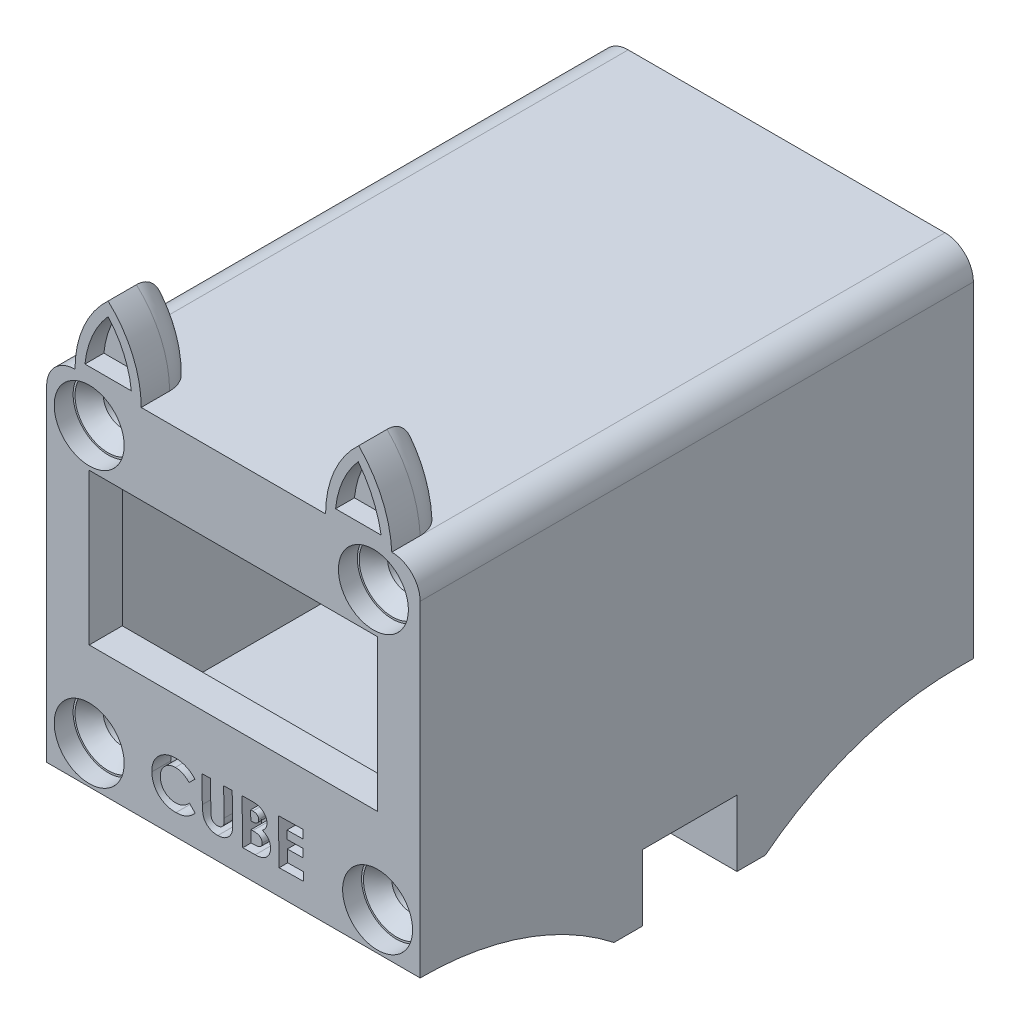
from build123d import *

# Parameters (mm, degrees)
ESQUISSE1_W              = 30.5
ESQUISSE1_H              = 16
BOSS_EXTRU_1_DEPTH       = 3.5
BOSS_EXTRU_2_START       = 55
BOSS_EXTRU_2_DEPTH       = 55
BOSS_EXTRU_3_START       = 1.5
BOSS_EXTRU_3_DEPTH       = 1.5
CONG_1_R                 = 2.5
ESQUISSE4_R              = 2
ENL_V_MAT_EXTRU_1_DEPTH  = 9.5
ESQUISSE5_R              = 3.7
ENL_V_MAT_EXTRU_5_DEPTH  = 2
BOSS_EXTRU_5_START       = -24.136848341
BOSS_EXTRU_5_OUTLINE_W   = 7.5
BOSS_EXTRU_5_OUTLINE_H   = 7
BOSS_EXTRU_5_DEPTH       = 6
BOSS_EXTRU_5_START_2     = 4.363151659
BOSS_EXTRU_5_2_OUTLINE_W = 7.5
BOSS_EXTRU_5_2_OUTLINE_H = 7
BOSS_EXTRU_5_2_DEPTH     = 6
BOSS_EXTRU_5_START_3     = -55
BOSS_EXTRU_5_3_OUTLINE_R = 2.25
BOSS_EXTRU_5_3_DEPTH     = 7
ESQUISSE7_W              = 0.5
ESQUISSE7_H              = 2.25
BOSS_EXTRU_6_DEPTH       = 7
CHANFREIN1_SIZE          = 1.5
ESQUISSE8_W              = 12.5
ESQUISSE8_H              = 5
ENL_V_MAT_EXTRU_6_DEPTH  = 2
BOSS_EXTRU_7_DEPTH       = 6
CONG_2_R                 = 3
ENL_V_MAT_EXTRU_7_DEPTH  = 2
ESQUISSE13_W             = 39.5
ESQUISSE13_H             = 3
BOSS_EXTRU_8_DEPTH       = 7
CONG_3_R                 = 33


with BuildPart() as part:
    # Esquisse1 → Boss.-Extru.1 (new body)
    with BuildSketch(Plane.XY):
        with BuildLine():
            Line((-17.882701422, 11.863151659), (15.617298578, 11.863151659))
            ThreePointArc((15.617298578, 11.863151659), (17.738618922, 10.984472002), (18.617298578, 8.863151659))
            Line((18.617298578, 8.863151659), (18.617298578, -25.636848341))
            Line((18.617298578, -25.636848341), (-20.882701422, -25.636848341))
            Line((-20.882701422, -25.636848341), (-20.882701422, 8.863151659))
            ThreePointArc((-20.882701422, 8.863151659), (-20.004021765, 10.984472002), (-17.882701422, 11.863151659))
        make_face()
        with Locations((-1.132701422, -4.636848341)):
            Rectangle(ESQUISSE1_W, ESQUISSE1_H, mode=Mode.SUBTRACT)
    extrude(amount=BOSS_EXTRU_1_DEPTH)

    # Esquisse2 → Boss.-Extru.2 (add)
    with BuildSketch(Plane(origin=(0, 0, 0), x_dir=(-1, 0, 0), z_dir=(0, 0, -1)).offset(BOSS_EXTRU_2_START)):
        with BuildLine():
            Line((-18.617298578, 8.863151659), (-18.617298578, -25.636848341))
            Line((-18.617298578, -25.636848341), (20.882701422, -25.636848341))
            Line((20.882701422, -25.636848341), (20.882701422, 8.863151659))
            ThreePointArc((20.882701422, 8.863151659), (20.004021765, 10.984472002), (17.882701422, 11.863151659))
            Line((17.882701422, 11.863151659), (-15.617298578, 11.863151659))
            ThreePointArc((-15.617298578, 11.863151659), (-17.738618922, 10.984472002), (-18.617298578, 8.863151659))
        make_face()
        with BuildLine():
            Line((-17.117298578, 8.863151659), (-17.117298578, -24.136848341))
            Line((-17.117298578, -24.136848341), (19.382701422, -24.136848341))
            Line((19.382701422, -24.136848341), (19.382701422, 8.863151659))
            ThreePointArc((19.382701422, 8.863151659), (18.943361594, 9.923811831), (17.882701422, 10.363151659))
            Line((17.882701422, 10.363151659), (-15.617298578, 10.363151659))
            ThreePointArc((-15.617298578, 10.363151659), (-16.67795875, 9.923811831), (-17.117298578, 8.863151659))
        make_face(mode=Mode.SUBTRACT)
    extrude(amount=-BOSS_EXTRU_2_DEPTH)

    # Esquisse3 → Boss.-Extru.3 (add)
    with BuildSketch(Plane(origin=(0, 0, 0), x_dir=(-1, 0, 0), z_dir=(0, 0, -1)).offset(BOSS_EXTRU_3_START)):
        with BuildLine():
            Line((-17.117298578, 8.863151659), (-17.117298578, 5.363151659))
            Line((-17.117298578, 5.363151659), (-5.117298578, 5.363151659))
            Line((-5.117298578, 5.363151659), (-5.117298578, 10.363151659))
            Line((-5.117298578, 10.363151659), (-15.617298578, 10.363151659))
            ThreePointArc((-15.617298578, 10.363151659), (-16.67795875, 9.923811831), (-17.117298578, 8.863151659))
        make_face()
        with BuildLine():
            Line((7.382701422, 5.363151659), (19.382701422, 5.363151659))
            Line((19.382701422, 5.363151659), (19.382701422, 8.863151659))
            ThreePointArc((19.382701422, 8.863151659), (18.943361594, 9.923811831), (17.882701422, 10.363151659))
            Line((17.882701422, 10.363151659), (7.382701422, 10.363151659))
            Line((7.382701422, 10.363151659), (7.382701422, 5.363151659))
        make_face()
        Polygon((-17.117298578, -19.136848341), (-17.117298578, -24.136848341), (19.382701422, -24.136848341), (19.382701422, -19.136848341), (7.382701422, -19.136848341), (7.382701422, -21.636848341), (-5.117298578, -21.636848341), (-5.117298578, -19.136848341), align=None)
    extrude(amount=-BOSS_EXTRU_3_DEPTH)

    # Congé1
    # the kernel refuses this fillet: 2.5 mm, written as the material it takes off along each edge
    with BuildSketch(Plane(origin=(-7.382701422, -21.636848341, -1.5), x_dir=(0, -1, 0), z_dir=(1, 0, 0))) as cong_1_piece_1:
        with BuildLine():
            CenterArc((2.291287847, -2.5), CONG_1_R, 90, 66.421821522)
            Line((0, -1.5), (-0.045825757, -1.48))
            ThreePointArc((-0.045825757, -1.48), (-0.05, -0.75), (-0.05, 0))
            Line((-0.05, 0), (0, 0.05))
            Line((0, 0.05), (2.291287847, 0.05))
            Line((2.291287847, 0.05), (2.291287847, 0))
        make_face()
    extrude(amount=12.5, mode=Mode.SUBTRACT)

    # Esquisse4 → Enlèv. mat.-Extru.1 (cut)
    with BuildSketch(Plane.XY.offset(3.5)):
        with Locations((-16.382701422, 7.463151659)):
            Circle(ESQUISSE4_R)
        with Locations((13.672123748, 7.463151659)):
            Circle(ESQUISSE4_R)
        with Locations((14.117298578, -21.636848341)):
            Circle(ESQUISSE4_R)
        with Locations((-16.382701422, -21.636848341)):
            Circle(ESQUISSE4_R)
    extrude(amount=-ENL_V_MAT_EXTRU_1_DEPTH, mode=Mode.SUBTRACT)

    # Esquisse5 → Enlèv. mat.-Extru.5 (cut)
    # profile 1 of 8: a face of its own
    with BuildSketch(Plane.XY.offset(3.5)):
        with Locations((-16.382701422, -21.636848341)):
            Circle(ESQUISSE5_R)
    # profile 2 of 8: a face of its own
    with BuildSketch(Plane.XY.offset(3.5)):
        with Locations((13.672123748, 7.463151659)):
            Circle(ESQUISSE5_R)
    # profile 3 of 8: a face of its own
    with BuildSketch(Plane.XY.offset(3.5)):
        with Locations((-16.382701422, 7.463151659)):
            Circle(ESQUISSE5_R)
    # profile 4 of 8: a face of its own
    with BuildSketch(Plane.XY.offset(3.5)):
        with Locations((14.117298578, -21.636848341)):
            Circle(ESQUISSE5_R)
    # profile 5 of 8: a face of its own
    with BuildSketch(Plane.XY.offset(3.5)):
        with BuildLine():
            Line((-5.197271772, -19.337280244), (-5.81738896, -19.950719246))
            add(Edge.make_bspline(
                [(-5.81738896, -19.950719246), (-5.871819564, -19.897567421), (-5.978262644, -19.793625088), (-6.14980206, -19.657794137), (-6.326117725, -19.543331454), (-6.507286193, -19.450164887), (-6.693200858, -19.377623021), (-6.884105922, -19.328467604), (-7.079521777, -19.298049175), (-7.211427694, -19.296858212), (-7.278003443, -19.296257107)],
                knots=[0, 0, 0, 0, 1.107517936, 2.16583336, 3.180811262, 4.164803658, 5.128205235, 6.080902515, 7.031390299, 8, 8, 8, 8], degree=3))
            add(Edge.make_bspline(
                [(-7.278003443, -19.296257107), (-7.333413818, -19.298800295), (-7.442490882, -19.303806641), (-7.60273827, -19.327665895), (-7.756036118, -19.367073937), (-7.902588534, -19.420408946), (-8.041863455, -19.488774674), (-8.174165728, -19.57127763), (-8.299586099, -19.668286917), (-8.416949838, -19.778036718), (-8.523301216, -19.898529229), (-8.616044277, -20.026777695), (-8.695450694, -20.161074742), (-8.758366804, -20.302700626), (-8.805989412, -20.450965409), (-8.840702352, -20.605057913), (-8.860260315, -20.766213815), (-8.860573866, -20.875755363), (-8.860733311, -20.931458429)],
                knots=[0, 0, 0, 0, 1.048412505, 2.063832949, 3.057056419, 4.036790455, 5.007644682, 5.985439106, 6.980135972, 8.001202913, 9.01945052, 10.014201915, 10.989849046, 11.964309438, 12.937953108, 13.930010865, 14.947388045, 16, 16, 16, 16], degree=3))
            add(Edge.make_bspline(
                [(-8.860733311, -20.931458429), (-8.859630371, -20.970283866), (-8.857447064, -21.047140151), (-8.84572326, -21.160565025), (-8.82785472, -21.270558379), (-8.802560042, -21.376798028), (-8.772511462, -21.479977108), (-8.734959575, -21.579678551), (-8.691111873, -21.675843196), (-8.64136139, -21.768548351), (-8.586475184, -21.857231565), (-8.524963973, -21.940589616), (-8.458073577, -22.018776866), (-8.386319073, -22.09232169), (-8.310084515, -22.161571925), (-8.227523878, -22.224214405), (-8.140457452, -22.282903933), (-8.048181122, -22.335802849), (-7.952349218, -22.383915276), (-7.852657851, -22.423316759), (-7.751335901, -22.458287538), (-7.647050882, -22.485848699), (-7.540281377, -22.506792045), (-7.430993375, -22.521074758), (-7.319465171, -22.528968655), (-7.24430624, -22.528656111), (-7.20645146, -22.528498694)],
                knots=[0, 0, 0, 0, 1.084339683, 2.146487657, 3.181598599, 4.194023116, 5.194340185, 6.180723861, 7.166307681, 8.143695569, 9.117040637, 10.076183867, 11.033640021, 11.98820891, 12.944016266, 13.906729597, 14.879628929, 15.874292992, 16.875122387, 17.871173017, 18.865321576, 19.866978021, 20.88060922, 21.901720907, 22.943174243, 24, 24, 24, 24], degree=3))
            add(Edge.make_bspline(
                [(-7.20645146, -22.528498694), (-7.142410659, -22.525709312), (-7.016482053, -22.520224325), (-6.832532074, -22.489078921), (-6.65733528, -22.440097018), (-6.517188449, -22.384261827), (-6.408242372, -22.328258985), (-6.324321421, -22.279127327), (-6.238886277, -22.221774411), (-6.15141302, -22.157057296), (-6.062347746, -22.084704852), (-5.970485491, -22.006091373), (-5.87848901, -21.917574703), (-5.816658759, -21.856001872), (-5.784952061, -21.824427179)],
                knots=[0, 0, 0, 0, 1.41063981, 2.773855175, 4.09758621, 5.41110672, 6.087658432, 6.793933879, 7.551475611, 8.352692833, 9.189425025, 10.078204459, 11.014498717, 12, 12, 12, 12], degree=3))
            Line((-5.784952061, -21.824427179), (-5.161972794, -22.451222552))
            add(Edge.make_bspline(
                [(-5.161972794, -22.451222552), (-5.204216916, -22.493584913), (-5.286843262, -22.576442527), (-5.414244655, -22.691486465), (-5.5387965, -22.797742602), (-5.662315126, -22.893569312), (-5.784318749, -22.979422831), (-5.904610428, -23.055913477), (-6.022722694, -23.123185782), (-6.14083352, -23.180097713), (-6.25996805, -23.229189881), (-6.382472006, -23.270973144), (-6.508847853, -23.307345968), (-6.639623934, -23.338130449), (-6.775103207, -23.361447509), (-6.914455775, -23.379883252), (-7.058088393, -23.391240742), (-7.155233735, -23.394204411), (-7.204543407, -23.39570873)],
                knots=[0, 0, 0, 0, 1.238006309, 2.421447812, 3.551562227, 4.625846467, 5.655722921, 6.638064549, 7.575270602, 8.467218343, 9.349693631, 10.240547926, 11.144627958, 12.070604012, 13.019592061, 13.98863614, 14.979058682, 16, 16, 16, 16], degree=3))
            add(Edge.make_bspline(
                [(-7.204543407, -23.39570873), (-7.294607103, -23.39500875), (-7.471065086, -23.393637309), (-7.730178139, -23.365694357), (-7.976876644, -23.315457154), (-8.211433292, -23.242451611), (-8.434256204, -23.147816962), (-8.644402275, -23.029976626), (-8.842795321, -22.890484739), (-9.026418937, -22.729823846), (-9.19434295, -22.552436591), (-9.340265544, -22.359511052), (-9.467358616, -22.155415955), (-9.568485127, -21.936592327), (-9.650822653, -21.70626194), (-9.708876612, -21.462771033), (-9.748639044, -21.207159434), (-9.755153146, -21.032101673), (-9.758472193, -20.942906746)],
                knots=[0, 0, 0, 0, 1.087512017, 2.130716215, 3.142552041, 4.124325543, 5.093336554, 6.061616248, 7.029377591, 8.017780395, 9.004300069, 9.974718837, 10.935355215, 11.902903039, 12.881009386, 13.885430519, 14.922590643, 16, 16, 16, 16], degree=3))
            add(Edge.make_bspline(
                [(-9.758472193, -20.942906746), (-9.758623488, -20.88468648), (-9.758922329, -20.769689229), (-9.745701517, -20.59960004), (-9.724385408, -20.434106959), (-9.691537045, -20.273603557), (-9.649722648, -20.117286513), (-9.597209754, -19.965944857), (-9.53509096, -19.81914832), (-9.462529363, -19.677979755), (-9.380079542, -19.542556865), (-9.290033878, -19.412298578), (-9.188795768, -19.290146132), (-9.080556905, -19.173751297), (-8.963068398, -19.064316772), (-8.837144507, -18.961007735), (-8.7014921, -18.865237133), (-8.558863122, -18.775361332), (-8.410127766, -18.695227409), (-8.257808526, -18.623791321), (-8.101700383, -18.563985857), (-7.942980802, -18.512962754), (-7.780499642, -18.474221047), (-7.615642427, -18.444093131), (-7.447233871, -18.426139834), (-7.334011008, -18.421726914), (-7.277049416, -18.419506807)],
                knots=[0, 0, 0, 0, 1.060904301, 2.095508784, 3.107204419, 4.100835301, 5.079558106, 6.054858582, 7.018512435, 7.98296801, 8.945330732, 9.907012296, 10.866735025, 11.834668634, 12.802602243, 13.791283079, 14.801432985, 15.827606885, 16.862552358, 17.879201671, 18.892225079, 19.907898824, 20.916000739, 21.934845788, 22.961036061, 24, 24, 24, 24], degree=3))
            add(Edge.make_bspline(
                [(-7.277049416, -18.419506807), (-7.228385151, -18.419701305), (-7.131611632, -18.420088084), (-6.986632725, -18.428523893), (-6.843046022, -18.445918437), (-6.700651704, -18.470589326), (-6.559696794, -18.503529902), (-6.419560319, -18.542936612), (-6.281241524, -18.592525267), (-6.143899626, -18.647148188), (-6.009909349, -18.710111414), (-5.879835054, -18.779643321), (-5.75493833, -18.856641981), (-5.633168577, -18.937906535), (-5.517659875, -19.028477601), (-5.406344677, -19.125051903), (-5.297493698, -19.226402979), (-5.230782782, -19.30020643), (-5.197271772, -19.337280244)],
                knots=[0, 0, 0, 0, 0.996133789, 1.980906781, 2.970894962, 3.955560356, 4.937812456, 5.933094958, 6.933749656, 7.944392395, 8.957903637, 9.962763717, 10.962040963, 11.960554496, 12.958048833, 13.964278723, 14.977392628, 16, 16, 16, 16], degree=3))
        make_face()
    # profile 6 of 8: a face of its own
    with BuildSketch(Plane.XY.offset(3.5)):
        with BuildLine():
            Line((-4.469881696, -18.456324694), (-3.564510602, -18.440106245))
            Line((-3.564510602, -18.440106245), (-3.511085122, -21.505393204))
            add(Edge.make_bspline(
                [(-3.511085122, -21.505393204), (-3.510296974, -21.537200376), (-3.508782988, -21.598300152), (-3.50394589, -21.686414808), (-3.497510674, -21.767253846), (-3.488788278, -21.841048348), (-3.479040212, -21.907799953), (-3.465128236, -21.96677677), (-3.451501365, -22.019124142), (-3.428750526, -22.078153249), (-3.39297845, -22.143462149), (-3.339697261, -22.213396442), (-3.275416303, -22.274683153), (-3.200215886, -22.326744984), (-3.115053224, -22.367279541), (-3.021843107, -22.397418286), (-2.92014212, -22.413347752), (-2.849996319, -22.414788671), (-2.813691792, -22.41553443)],
                knots=[0, 0, 0, 0, 1.153883229, 2.216544329, 3.200222797, 4.09435915, 4.911621754, 5.644711592, 6.291110307, 6.871586097, 7.934747804, 8.979736624, 10.048389518, 11.142566996, 12.282590482, 13.457098253, 14.683900616, 16, 16, 16, 16], degree=3))
            add(Edge.make_bspline(
                [(-2.813691792, -22.41553443), (-2.775065926, -22.413864218), (-2.70028749, -22.410630742), (-2.593087998, -22.386245567), (-2.493639772, -22.352067573), (-2.404896052, -22.301578279), (-2.326742535, -22.241664791), (-2.260037163, -22.174047062), (-2.207988364, -22.09832133), (-2.174375831, -22.028903829), (-2.156094948, -21.96570074), (-2.143646076, -21.908666069), (-2.133576994, -21.842040119), (-2.124962974, -21.766009451), (-2.119289995, -21.680374943), (-2.117242306, -21.585221912), (-2.114581679, -21.480279052), (-2.115709876, -21.407129844), (-2.116298463, -21.368967423)],
                knots=[0, 0, 0, 0, 1.272710189, 2.463926041, 3.611916474, 4.729555179, 5.814220856, 6.852713593, 7.847815066, 8.833194449, 9.380751489, 10.014464388, 10.757725182, 11.602161931, 12.537827812, 13.587228776, 14.741241432, 16, 16, 16, 16], degree=3))
            Line((-2.116298463, -21.368967423), (-2.167815891, -18.416255584))
            Line((-2.167815891, -18.416255584), (-1.262444797, -18.400037134))
            Line((-1.262444797, -18.400037134), (-1.213789449, -21.223955404))
            add(Edge.make_bspline(
                [(-1.213789449, -21.223955404), (-1.212948604, -21.281195604), (-1.211332347, -21.391221689), (-1.212272022, -21.549301892), (-1.215935489, -21.694036838), (-1.22245951, -21.825103666), (-1.231545649, -21.942573534), (-1.24443498, -22.046195393), (-1.257412217, -22.136671931), (-1.28223535, -22.239227271), (-1.322376873, -22.35807304), (-1.3875945, -22.495394243), (-1.473240081, -22.629380072), (-1.573339484, -22.760019437), (-1.687618888, -22.881463895), (-1.81324252, -22.987736894), (-1.947431361, -23.078707391), (-2.092148054, -23.151062059), (-2.246578267, -23.209722836), (-2.413423981, -23.24928739), (-2.592106433, -23.277098482), (-2.715633411, -23.282082061), (-2.77934684, -23.284652519)],
                knots=[0, 0, 0, 0, 1.153472595, 2.217184297, 3.185099341, 4.07051063, 4.861268754, 5.558305062, 6.174586143, 6.701468234, 7.682215346, 8.696853337, 9.756446119, 10.88046011, 12.009122008, 13.109359499, 14.189902916, 15.267402113, 16.362364988, 17.51086112, 18.716138159, 20, 20, 20, 20], degree=3))
            add(Edge.make_bspline(
                [(-2.77934684, -23.284652519), (-2.821658031, -23.284507307), (-2.904785685, -23.284222013), (-3.027766005, -23.275372027), (-3.146884183, -23.259967094), (-3.261482675, -23.233971833), (-3.372725882, -23.204655878), (-3.479199914, -23.16456705), (-3.58192065, -23.118199004), (-3.67999693, -23.064733377), (-3.772553217, -23.005878815), (-3.858083122, -22.941378962), (-3.938672774, -22.875253277), (-4.011763973, -22.804101554), (-4.077247506, -22.728701788), (-4.137129909, -22.649826079), (-4.190260976, -22.567329744), (-4.237785517, -22.479040237), (-4.278055935, -22.380864054), (-4.313292576, -22.269172084), (-4.343380996, -22.14189322), (-4.368646376, -21.999147267), (-4.389393062, -21.84124855), (-4.405707065, -21.668156912), (-4.415513096, -21.479404775), (-4.419273877, -21.348305363), (-4.421226348, -21.280242964)],
                knots=[0, 0, 0, 0, 1.022639701, 2.009152622, 2.979018291, 3.923003033, 4.848140333, 5.757879613, 6.669663217, 7.571014917, 8.456087748, 9.318703783, 10.159353097, 10.974877145, 11.781290535, 12.571638451, 13.367092774, 14.151284186, 14.992249845, 15.928343413, 16.980047639, 18.151803588, 19.431574799, 20.82925445, 22.353855715, 24, 24, 24, 24], degree=3))
            Line((-4.421226348, -21.280242964), (-4.469881696, -18.456324694))
        make_face()
    # profile 7 of 8: a face of its own
    with BuildSketch(Plane.XY.offset(3.5)):
        with BuildLine():
            Line((-0.1436385, -23.09069957), (-0.225684774, -18.353958284))
            Line((-0.225684774, -18.353958284), (0.518455851, -18.34155594))
            add(Edge.make_bspline(
                [(0.518455851, -18.34155594), (0.570608682, -18.340595175), (0.671098873, -18.338743933), (0.816452382, -18.341297958), (0.951004949, -18.344719204), (1.075149173, -18.350887363), (1.188337775, -18.361766636), (1.290860944, -18.37382174), (1.382398097, -18.388424254), (1.439157446, -18.401975788), (1.465804108, -18.408337791)],
                knots=[0, 0, 0, 0, 1.314712838, 2.533242045, 3.663945096, 4.707527634, 5.665491831, 6.529505176, 7.309650677, 8, 8, 8, 8], degree=3))
            add(Edge.make_bspline(
                [(1.465804108, -18.408337791), (1.500609288, -18.417719365), (1.569028432, -18.436161426), (1.667997442, -18.471687989), (1.761466046, -18.514008966), (1.850515466, -18.560986784), (1.932854525, -18.616255983), (2.010366152, -18.676455972), (2.083353351, -18.742243156), (2.149774151, -18.814676566), (2.209567564, -18.891689232), (2.262933824, -18.972349847), (2.307250514, -19.057315895), (2.345298817, -19.145371036), (2.37311042, -19.237478288), (2.395957187, -19.332532692), (2.409005996, -19.431661729), (2.411760589, -19.499074303), (2.413152365, -19.533134967)],
                knots=[0, 0, 0, 0, 1.088685469, 2.140110345, 3.172132446, 4.186520325, 5.177714923, 6.163540948, 7.149694591, 8.142331401, 9.128157426, 10.092736644, 11.059657251, 12.019632704, 12.985884922, 13.962303995, 14.970440161, 16, 16, 16, 16], degree=3))
            add(Edge.make_bspline(
                [(2.413152365, -19.533134967), (2.412569571, -19.577079821), (2.411419156, -19.663825421), (2.392280967, -19.791240512), (2.357178679, -19.912301276), (2.309442129, -20.028519021), (2.244479854, -20.139711372), (2.160982211, -20.246020426), (2.060297235, -20.34975876), (1.982953436, -20.412582862), (1.942817329, -20.445184245)],
                knots=[0, 0, 0, 0, 0.986139546, 1.946604881, 2.882408791, 3.810771673, 4.761229246, 5.763984241, 6.839661762, 8, 8, 8, 8], degree=3))
            add(Edge.make_bspline(
                [(1.942817329, -20.445184245), (1.977960138, -20.461707471), (2.046846017, -20.494095803), (2.145329731, -20.547299744), (2.236300269, -20.604911774), (2.320204639, -20.665312454), (2.395905443, -20.730307701), (2.466127446, -20.796503177), (2.528111332, -20.867303968), (2.582914009, -20.941585834), (2.631557765, -21.01866163), (2.67396406, -21.099252825), (2.709139892, -21.183711403), (2.738717917, -21.271709295), (2.762749009, -21.363125727), (2.779537847, -21.458239925), (2.791590025, -21.556648608), (2.793693926, -21.623688238), (2.794762942, -21.657751854)],
                knots=[0, 0, 0, 0, 1.181687758, 2.316308845, 3.403720973, 4.456783915, 5.459269969, 6.438072465, 7.391278386, 8.318433729, 9.244780565, 10.162493025, 11.086359406, 12.025907808, 12.985967188, 13.959781145, 14.96334105, 16, 16, 16, 16], degree=3))
            add(Edge.make_bspline(
                [(2.794762942, -21.657751854), (2.793466935, -21.72310351), (2.790911431, -21.851965782), (2.754321484, -22.041385046), (2.691904786, -22.221710193), (2.604948651, -22.391238404), (2.497713286, -22.545850073), (2.373861891, -22.682892748), (2.23432408, -22.799265802), (2.105307331, -22.879678734), (1.992264604, -22.930826436), (1.900313238, -22.966897257), (1.799987301, -22.996062048), (1.691446875, -23.01945625), (1.575619093, -23.039452051), (1.451817725, -23.054900994), (1.320284889, -23.064129068), (1.22985498, -23.066556343), (1.183412281, -23.067802935)],
                knots=[0, 0, 0, 0, 1.2949667, 2.553452515, 3.808517407, 5.069846904, 6.32124296, 7.531679581, 8.723239391, 9.915734281, 10.533991925, 11.183125503, 11.873883276, 12.604086575, 13.385154647, 14.205304943, 15.078286334, 16, 16, 16, 16], degree=3))
            Line((1.183412281, -23.067802935), (-0.1436385, -23.09069957))
        make_face()
        with BuildLine():
            Line((0.69018061, -19.198271685), (0.708307113, -20.19713737))
            Line((0.708307113, -20.19713737), (0.90483656, -20.193321265))
            add(Edge.make_bspline(
                [(0.90483656, -20.193321265), (0.956208011, -20.191035548), (1.052515949, -20.186750432), (1.186085128, -20.157884376), (1.299551492, -20.11425309), (1.391112455, -20.050626492), (1.460834928, -19.971899698), (1.511122416, -19.880880784), (1.539195517, -19.77710856), (1.541125704, -19.704391723), (1.542126223, -19.666698669)],
                knots=[0, 0, 0, 0, 1.312707258, 2.460980262, 3.478643817, 4.401206268, 5.282388096, 6.144801073, 7.038350448, 8, 8, 8, 8], degree=3))
            add(Edge.make_bspline(
                [(1.542126223, -19.666698669), (1.539751836, -19.631492736), (1.535171859, -19.563583702), (1.504815314, -19.467550159), (1.455196701, -19.383393308), (1.385671931, -19.312270254), (1.296604103, -19.256210293), (1.188346367, -19.217486209), (1.061192841, -19.196116807), (0.970431846, -19.19503353), (0.922009036, -19.19445558)],
                knots=[0, 0, 0, 0, 0.955321227, 1.842727548, 2.705949773, 3.585128448, 4.516788585, 5.5383931, 6.686683367, 8, 8, 8, 8], degree=3))
            Line((0.922009036, -19.19445558), (0.69018061, -19.198271685))
        make_face(mode=Mode.SUBTRACT)
        with BuildLine():
            Line((0.721663483, -21.001381661), (0.742652065, -22.215857322))
            Line((0.742652065, -22.215857322), (0.967802305, -22.212041217))
            add(Edge.make_bspline(
                [(0.967802305, -22.212041217), (1.012652536, -22.210743559), (1.098609861, -22.208256544), (1.221851435, -22.200059794), (1.333258646, -22.186709492), (1.433414297, -22.169924704), (1.521835647, -22.148407294), (1.59899859, -22.122418355), (1.665447565, -22.093947694), (1.720151779, -22.058555954), (1.76565085, -22.019427719), (1.805626853, -21.977519464), (1.837592402, -21.930260152), (1.865073513, -21.880005089), (1.885814844, -21.825779146), (1.900413706, -21.767517218), (1.907787049, -21.705332754), (1.908239963, -21.662539064), (1.908472377, -21.640579378)],
                knots=[0, 0, 0, 0, 1.717636525, 3.291921594, 4.726460096, 6.011397177, 7.177705282, 8.205611692, 9.12651322, 9.936987323, 10.688341583, 11.420514266, 12.146588791, 12.865586497, 13.6094072, 14.362337867, 15.159629654, 16, 16, 16, 16], degree=3))
            add(Edge.make_bspline(
                [(1.908472377, -21.640579378), (1.907378513, -21.615734136), (1.905249289, -21.567372493), (1.893811515, -21.496853217), (1.874427808, -21.430751053), (1.848788206, -21.368035143), (1.815191041, -21.309833092), (1.774592774, -21.255629516), (1.726756616, -21.206069517), (1.671373967, -21.160695577), (1.608612407, -21.119216748), (1.535630224, -21.085326943), (1.454503358, -21.055260259), (1.36308088, -21.033314086), (1.262807253, -21.015024214), (1.152854849, -21.002698243), (1.033683673, -20.997573575), (0.951268875, -20.997568289), (0.908652666, -20.997565556)],
                knots=[0, 0, 0, 0, 0.885215198, 1.723084971, 2.536722044, 3.333875255, 4.130384563, 4.923181272, 5.740200812, 6.576921611, 7.469065062, 8.411276178, 9.435983098, 10.545725126, 11.754232734, 13.064979957, 14.482318325, 16, 16, 16, 16], degree=3))
            Line((0.908652666, -20.997565556), (0.721663483, -21.001381661))
        make_face(mode=Mode.SUBTRACT)
    # profile 8 of 8: a face of its own
    with BuildSketch(Plane.XY.offset(3.5)):
        Polygon((3.622697326, -18.261364368), (6.209063011, -18.216525125), (6.224327434, -19.098999584), (4.533792578, -19.128574404), (4.548102975, -19.985290149), (6.238637831, -19.95571533), (6.253902254, -20.821971339), (4.563367398, -20.851546159), (4.585310006, -22.097504693), (6.275844862, -22.067929873), (6.291109285, -22.953266411), (3.7047436, -22.998105654), align=None)
    extrude(amount=-ENL_V_MAT_EXTRU_5_DEPTH, mode=Mode.SUBTRACT)

    # Boss.-Extru.5: read off the stored shape, not the designer's step
    # Boss.-Extru.5 outline → Boss.-Extru.5 (add)
    with BuildSketch(Plane(origin=(0, 0, 0), x_dir=(1, 0, 0), z_dir=(0, 1, 0)).offset(BOSS_EXTRU_5_START)):
        with Locations((-1.132701422, 51.5)):
            Rectangle(BOSS_EXTRU_5_OUTLINE_W, BOSS_EXTRU_5_OUTLINE_H)
    extrude(amount=BOSS_EXTRU_5_DEPTH)

    # Boss.-Extru.5 2 outline → Boss.-Extru.5 2 (add)
    with BuildSketch(Plane(origin=(0, 0, 0), x_dir=(1, 0, 0), z_dir=(0, 1, 0)).offset(BOSS_EXTRU_5_START_2)):
        with Locations((-1.132701422, 51.5)):
            Rectangle(BOSS_EXTRU_5_2_OUTLINE_W, BOSS_EXTRU_5_2_OUTLINE_H)
    extrude(amount=BOSS_EXTRU_5_2_DEPTH)

    # Boss.-Extru.5 3 outline → Boss.-Extru.5 3 (cut)
    with BuildSketch(Plane.XY.offset(BOSS_EXTRU_5_START_3)):
        with BuildLine():
            Line((-4.882701422, -18.136848341), (-4.882701422, -21.886848341))
            ThreePointArc((-4.882701422, -21.886848341), (-3.784351851, -19.235197912), (-1.132701422, -18.136848341))
            Line((-1.132701422, -18.136848341), (-4.882701422, -18.136848341))
        make_face()
        with BuildLine():
            Line((2.617298578, -18.136848341), (-1.132701422, -18.136848341))
            ThreePointArc((-1.132701422, -18.136848341), (1.518949007, -19.235197912), (2.617298578, -21.886848341))
            Line((2.617298578, -21.886848341), (2.617298578, -18.136848341))
        make_face()
        with Locations((-1.132701422, -21.886848341)):
            Circle(BOSS_EXTRU_5_3_OUTLINE_R)
        with BuildLine():
            Line((2.617298578, 4.363151659), (2.617298578, 8.113151659))
            ThreePointArc((2.617298578, 8.113151659), (1.518949007, 5.46150123), (-1.132701422, 4.363151659))
            Line((-1.132701422, 4.363151659), (2.617298578, 4.363151659))
        make_face()
        with BuildLine():
            Line((-4.882701422, 4.363151659), (-1.132701422, 4.363151659))
            ThreePointArc((-1.132701422, 4.363151659), (-3.784351851, 5.46150123), (-4.882701422, 8.113151659))
            Line((-4.882701422, 8.113151659), (-4.882701422, 4.363151659))
        make_face()
        with Locations((-1.132701422, 8.113151659)):
            Circle(BOSS_EXTRU_5_3_OUTLINE_R)
    extrude(amount=BOSS_EXTRU_5_3_DEPTH, mode=Mode.SUBTRACT)

    # Esquisse7 → Boss.-Extru.6 (add)
    with BuildSketch(Plane(origin=(0, 0, -55), x_dir=(-1, 0, 0), z_dir=(0, 0, -1))):
        with BuildLine():
            Line((-2.617298578, 8.113151659), (-3.117298578, 8.113151659))
            ThreePointArc((-3.117298578, 8.113151659), (1.132701422, 3.863151659), (5.382701422, 8.113151659))
            Line((5.382701422, 8.113151659), (4.882701422, 8.113151659))
            ThreePointArc((4.882701422, 8.113151659), (1.132701422, 4.363151659), (-2.617298578, 8.113151659))
        make_face()
        with Locations((5.132701422, 9.238151659)):
            Rectangle(ESQUISSE7_W, ESQUISSE7_H)
        with Locations((-2.867298578, 9.238151659)):
            Rectangle(ESQUISSE7_W, ESQUISSE7_H)
    extrude(amount=-BOSS_EXTRU_6_DEPTH)

    # Chanfrein1
    chanfrein1_edges = [part.edges().sort_by_distance(p)[0] for p in [
        (-18.382701422, -21.636848341, 1.5),
        (11.672123748, 7.463151659, 1.5),
        (-18.382701422, 7.463151659, 1.5),
        (12.117298578, -21.636848341, 1.5),
    ]]
    chamfer(chanfrein1_edges, length=CHANFREIN1_SIZE)

    # Esquisse8 → Enlèv. mat.-Extru.6 (cut)
    with BuildSketch(Plane(origin=(0, 0, 0), x_dir=(-1, 0, 0), z_dir=(0, 0, -1))):
        with Locations((1.132701422, 7.863151659)):
            Rectangle(ESQUISSE8_W, ESQUISSE8_H)
    extrude(amount=-ENL_V_MAT_EXTRU_6_DEPTH, mode=Mode.SUBTRACT)

    # Esquisse10 → Boss.-Extru.7 (add)
    with BuildSketch(Plane.XY.offset(3.5)):
        with BuildLine():
            ThreePointArc((12.117298578, 19.863151659), (9.530584752, 16.229213958), (8.617298578, 11.863151659))
            Line((8.617298578, 11.863151659), (15.617298578, 11.863151659))
            ThreePointArc((15.617298578, 11.863151659), (14.606570843, 16.186583274), (12.117298578, 19.863151659))
        make_face()
        with BuildLine():
            ThreePointArc((-14.382701422, 19.863151659), (-16.969415248, 16.229213958), (-17.882701422, 11.863151659))
            Line((-17.882701422, 11.863151659), (-10.882701422, 11.863151659))
            ThreePointArc((-10.882701422, 11.863151659), (-11.795987595, 16.229213958), (-14.382701422, 19.863151659))
        make_face()
    extrude(amount=-BOSS_EXTRU_7_DEPTH)

    # Congé2
    cong_2_edges = [part.edges().sort_by_distance(p)[0] for p in [
        (14.606570843, 16.186583274, -2.5),
        (9.530584752, 16.229213958, -2.5),
        (-11.795987595, 16.229213958, -2.5),
        (-16.969415248, 16.229213958, -2.5),
    ]]
    fillet(cong_2_edges, radius=CONG_2_R)

    # Esquisse12 → Enlèv. mat.-Extru.7 (cut)
    with BuildSketch(Plane.XY.offset(3.5)):
        with BuildLine():
            Line((-16.832030136, 12.863151659), (-11.933372707, 12.863151659))
            ThreePointArc((-11.933372707, 12.863151659), (-12.718607115, 15.843133178), (-14.382701422, 18.43690901))
            ThreePointArc((-14.382701422, 18.43690901), (-16.046795728, 15.843133178), (-16.832030136, 12.863151659))
        make_face()
        with BuildLine():
            Line((9.667969864, 12.863151659), (14.487131851, 12.863151659))
            ThreePointArc((14.487131851, 12.863151659), (13.618374663, 15.770976665), (12.06592218, 18.378672317))
            ThreePointArc((12.06592218, 18.378672317), (10.437652432, 15.80755358), (9.667969864, 12.863151659))
        make_face()
    extrude(amount=-ENL_V_MAT_EXTRU_7_DEPTH, mode=Mode.SUBTRACT)

    # Esquisse13 → Boss.-Extru.8 (add)
    with BuildSketch(Plane.XZ.offset(25.636848341)):
        with Locations((-1.132701422, -18.5)):
            Rectangle(ESQUISSE13_W, ESQUISSE13_H)
        with Locations((-1.132701422, -31.5)):
            Rectangle(ESQUISSE13_W, ESQUISSE13_H)
    extrude(amount=BOSS_EXTRU_8_DEPTH)

    # Congé3
    # the kernel refuses this fillet: 33 mm, written as the material it adds along each edge
    with BuildSketch(Plane(origin=(-20.882701422, -25.636848341, -17), x_dir=(0, 0, 1), z_dir=(1, 0, 0))) as cong_3_piece_1:
        with BuildLine():
            CenterArc((20.322401433, 33), CONG_3_R, 231.987720456, 38.012279544)
            Line((0, 7), (0, 0))
            Line((0, 0), (20.322401433, 0))
        make_face()
    extrude(amount=39.5)
    with BuildSketch(Plane(origin=(-20.882701422, -25.636848341, -33), x_dir=(0, 0, -1), z_dir=(1, 0, 0))) as cong_3_piece_2:
        with BuildLine():
            CenterArc((20.322401433, -33), CONG_3_R, 90, 38.012279544)
            Line((0, -7), (0, 0))
            Line((0, 0), (20.322401433, 0))
        make_face()
    extrude(amount=39.5)


solid = part.part
